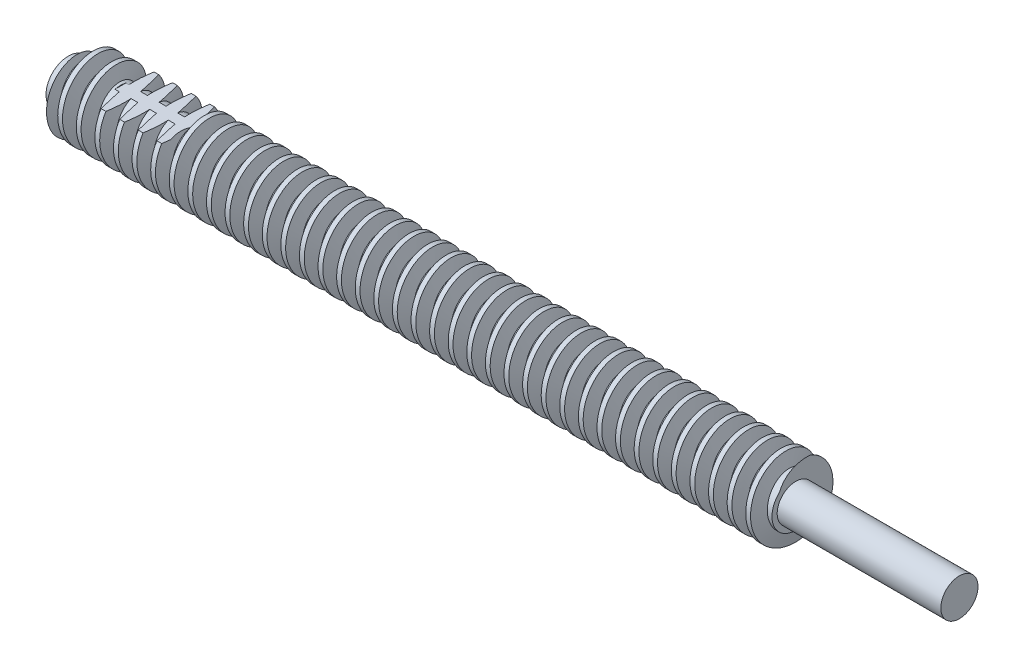
from build123d import *

# Parameters (mm, degrees)
SKETCH1_W          = 76.2
SKETCH1_H          = 3.175
CUT_SWEEP1_PITCH   = 1.5875
SKETCH6_W          = 6.096
SKETCH6_H          = 2.032
CUT_EXTRUDE1_DEPTH = 6.35
SKETCH7_R          = 3.175
SKETCH7_R_2        = 1.5875
CUT_EXTRUDE2_DEPTH = 13.97


with BuildPart() as part:
    # Sketch1 → Revolve1 (revolve)
    with BuildSketch(Plane.XY):
        with Locations((-31.75, 1.5875)):
            Rectangle(SKETCH1_W, SKETCH1_H)
    revolve(axis=Axis((6.35, 0, 0), (-1, 0, 0)))

    # Cut-Sweep1: arcs per turn and ends read off the stored shape
    # Cut-Sweep1: the profile of Sketch3 profile screwed along a right-hand helix through 40 turns, 8 arcs to a turn; built about Z, then put on its axis
    cut_sweep1_z = Axis((0, 0, 0), (0, 0, 1))
    cut_sweep1_corners = [(3.1753, 0, -0.955350567), (2.032, 0, -0.659673083), (2.032, 0, -0.071205883), (3.1753, 0, 0.224471602)]
    with BuildLine(mode=Mode.PRIVATE) as cut_sweep1_profile:
        Line(cut_sweep1_corners[0], cut_sweep1_corners[1])
        Line(cut_sweep1_corners[1], cut_sweep1_corners[2])
        Line(cut_sweep1_corners[2], cut_sweep1_corners[3])
        Line(cut_sweep1_corners[3], cut_sweep1_corners[0])
    cut_sweep1_cap = Face(cut_sweep1_profile.wire())
    cut_sweep1_turn_angles = [0, 22.5, 45, 67.5, 90, 112.5, 135, 157.5, 180, 202.5, 225, 247.5, 270, 292.5, 315, 337.5, 360]
    cut_sweep1_turn_weights = [1, 0.9238795325112867, 1, 0.9238795325112867, 1, 0.9238795325112867, 1, 0.9238795325112867, 1, 0.9238795325112867, 1, 0.9238795325112867, 1, 0.9238795325112867, 1, 0.9238795325112867, 1]
    cut_sweep1_turn_rails = [Edge.make_bspline([Vector(p[0], p[1], 0).rotate(cut_sweep1_z, cut_sweep1_turn_angles[k]) / cut_sweep1_turn_weights[k] + Vector(0, 0, p[2] + CUT_SWEEP1_PITCH * cut_sweep1_turn_angles[k] / 360) for k in range(17)], [0, 0, 0, 1, 1, 2, 2, 3, 3, 4, 4, 5, 5, 6, 6, 7, 7, 8, 8, 8], 2, cut_sweep1_turn_weights) for p in cut_sweep1_corners]
    cut_sweep1_turn_sides = [Face.make_surface_from_curves(cut_sweep1_turn_rails[p[0]], cut_sweep1_turn_rails[p[1]]) for p in [(0, 1), (1, 2), (2, 3), (3, 0)]]
    cut_sweep1 = Plane(origin=(-69.85, 0, 0), x_dir=(0, 0.7071067811865438, -0.7071067811865512), z_dir=(1, 0, 0)) * Solid(Shell([*[p.moved(Location((0, 0, CUT_SWEEP1_PITCH * i))) for i in range(40) for p in cut_sweep1_turn_sides], cut_sweep1_cap, cut_sweep1_cap.rotate(cut_sweep1_z, 14400).moved(Location((0, 0, CUT_SWEEP1_PITCH * 14400 / 360)))]))
    add(cut_sweep1, mode=Mode.SUBTRACT)

    # Sketch4 → Cut-Revolve1 (revolve, cut)
    with BuildSketch(Plane.XY, mode=Mode.PRIVATE) as cut_revolve1_sk:
        Polygon((-69.215, 1.978238833), (-69.723, 1.978238833), (-69.85, 1.660738833), (-69.85, 3.523202068), (-68.323015061, 3.523202068), align=None)
    revolve(cut_revolve1_sk.sketch.rotate(Axis((-71.928988702, 0.073238833, 0), (1, 0, 0)), 90), axis=Axis((-71.928988702, 0.073238833, 0), (1, 0, 0)), mode=Mode.SUBTRACT)

    # Sketch6 → Cut-Extrude1 (cut, symmetric)
    with BuildSketch(Plane.XY):
        with Locations((-62.23, 2.994238833)):
            Rectangle(SKETCH6_W, SKETCH6_H)
    extrude(amount=CUT_EXTRUDE1_DEPTH, both=True, mode=Mode.SUBTRACT)

    # Sketch7 → Cut-Extrude2 (cut)
    with BuildSketch(Plane(origin=(6.35, 0, 0), x_dir=(0, 0, -1), z_dir=(1, 0, 0))):
        Circle(SKETCH7_R)
        Circle(SKETCH7_R_2, mode=Mode.SUBTRACT)
    extrude(amount=-CUT_EXTRUDE2_DEPTH, mode=Mode.SUBTRACT)


solid = part.part
